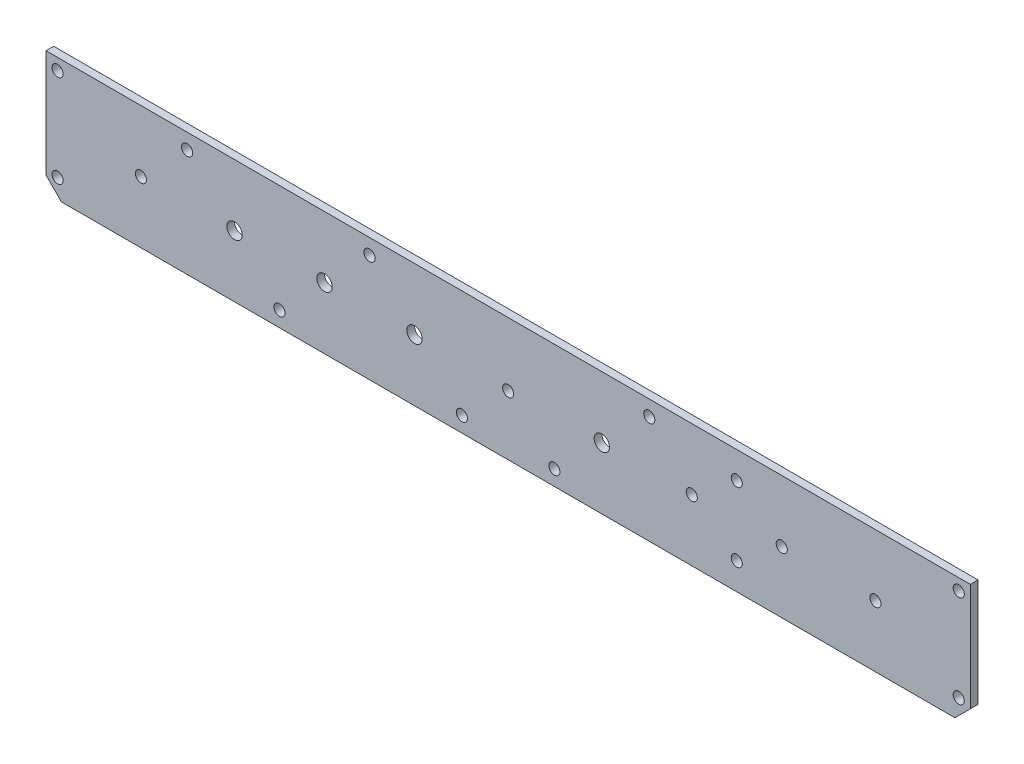
from build123d import *

# Parameters (mm, degrees)
SKETCH1_W           = 381
SKETCH1_H           = 50.8
BOSS_EXTRUDE1_DEPTH = 3.175
CUT_EXTRUDE1_REACH  = 386.385
SKETCH2_R           = 2.286
SKETCH2_R_2         = 3.175


with BuildPart() as part:
    # Sketch1 → Boss-Extrude1 (new body)
    with BuildSketch(Plane.XY):
        with Locations((190.5, 25.4)):
            Rectangle(SKETCH1_W, SKETCH1_H)
    extrude(amount=BOSS_EXTRUDE1_DEPTH)

    # Sketch2 → Cut-Extrude1 (cut, up to next)
    with BuildSketch(Plane.XY.offset(3.175), mode=Mode.PRIVATE) as cut_extrude1_sk1:
        with Locations((39.116, 25.4)):
            Circle(SKETCH2_R)
    cut_extrude1_tool1 = extrude(cut_extrude1_sk1.sketch, amount=-CUT_EXTRUDE1_REACH, mode=Mode.PRIVATE) & part.part
    # Sketch2 → Cut-Extrude1 (cut, up to next)
    with BuildSketch(Plane.XY.offset(3.175), mode=Mode.PRIVATE) as cut_extrude1_sk2:
        with Locations((190.5, 24.60625)):
            Circle(SKETCH2_R)
    cut_extrude1_tool2 = extrude(cut_extrude1_sk2.sketch, amount=-CUT_EXTRUDE1_REACH, mode=Mode.PRIVATE) & part.part
    # Sketch2 → Cut-Extrude1 (cut, up to next)
    with BuildSketch(Plane.XY.offset(3.175), mode=Mode.PRIVATE) as cut_extrude1_sk3:
        with Locations((114.808, 25.4)):
            Circle(SKETCH2_R_2)
    cut_extrude1_tool3 = extrude(cut_extrude1_sk3.sketch, amount=-CUT_EXTRUDE1_REACH, mode=Mode.PRIVATE) & part.part
    # Sketch2 → Cut-Extrude1 (cut, up to next)
    with BuildSketch(Plane.XY.offset(3.175), mode=Mode.PRIVATE) as cut_extrude1_sk4:
        with Locations((77.724, 25.4)):
            Circle(SKETCH2_R_2)
    cut_extrude1_tool4 = extrude(cut_extrude1_sk4.sketch, amount=-CUT_EXTRUDE1_REACH, mode=Mode.PRIVATE) & part.part
    # Sketch2 → Cut-Extrude1 (cut, up to next)
    with BuildSketch(Plane.XY.offset(3.175), mode=Mode.PRIVATE) as cut_extrude1_sk5:
        with Locations((151.892, 25.4)):
            Circle(SKETCH2_R_2)
    cut_extrude1_tool5 = extrude(cut_extrude1_sk5.sketch, amount=-CUT_EXTRUDE1_REACH, mode=Mode.PRIVATE) & part.part
    # Sketch2 → Cut-Extrude1 (cut, up to next)
    with BuildSketch(Plane.XY.offset(3.175), mode=Mode.PRIVATE) as cut_extrude1_sk6:
        with Locations((229.108, 25.4)):
            Circle(SKETCH2_R_2)
    cut_extrude1_tool6 = extrude(cut_extrude1_sk6.sketch, amount=-CUT_EXTRUDE1_REACH, mode=Mode.PRIVATE) & part.part
    # Sketch2 → Cut-Extrude1 (cut, up to next)
    with BuildSketch(Plane.XY.offset(3.175), mode=Mode.PRIVATE) as cut_extrude1_sk7:
        with Locations((303.276, 25.4)):
            Circle(SKETCH2_R)
    cut_extrude1_tool7 = extrude(cut_extrude1_sk7.sketch, amount=-CUT_EXTRUDE1_REACH, mode=Mode.PRIVATE) & part.part
    # Sketch2 → Cut-Extrude1 (cut, up to next)
    with BuildSketch(Plane.XY.offset(3.175), mode=Mode.PRIVATE) as cut_extrude1_sk8:
        with Locations((266.192, 25.4)):
            Circle(SKETCH2_R)
    cut_extrude1_tool8 = extrude(cut_extrude1_sk8.sketch, amount=-CUT_EXTRUDE1_REACH, mode=Mode.PRIVATE) & part.part
    # Sketch2 → Cut-Extrude1 (cut, up to next)
    with BuildSketch(Plane.XY.offset(3.175), mode=Mode.PRIVATE) as cut_extrude1_sk9:
        with Locations((341.884, 25.4)):
            Circle(SKETCH2_R)
    cut_extrude1_tool9 = extrude(cut_extrude1_sk9.sketch, amount=-CUT_EXTRUDE1_REACH, mode=Mode.PRIVATE) & part.part
    # Sketch2 → Cut-Extrude1 (cut, up to next)
    with BuildSketch(Plane.XY.offset(3.175), mode=Mode.PRIVATE) as cut_extrude1_sk10:
        with Locations((58.166, 44.45)):
            Circle(SKETCH2_R)
    cut_extrude1_tool10 = extrude(cut_extrude1_sk10.sketch, amount=-CUT_EXTRUDE1_REACH, mode=Mode.PRIVATE) & part.part
    # Sketch2 → Cut-Extrude1 (cut, up to next)
    with BuildSketch(Plane.XY.offset(3.175), mode=Mode.PRIVATE) as cut_extrude1_sk11:
        with Locations((171.45, 6.35)):
            Circle(SKETCH2_R)
    cut_extrude1_tool11 = extrude(cut_extrude1_sk11.sketch, amount=-CUT_EXTRUDE1_REACH, mode=Mode.PRIVATE) & part.part
    # Sketch2 → Cut-Extrude1 (cut, up to next)
    with BuildSketch(Plane.XY.offset(3.175), mode=Mode.PRIVATE) as cut_extrude1_sk12:
        with Locations((209.55, 6.35)):
            Circle(SKETCH2_R)
    cut_extrude1_tool12 = extrude(cut_extrude1_sk12.sketch, amount=-CUT_EXTRUDE1_REACH, mode=Mode.PRIVATE) & part.part
    # Sketch2 → Cut-Extrude1 (cut, up to next)
    with BuildSketch(Plane.XY.offset(3.175), mode=Mode.PRIVATE) as cut_extrude1_sk13:
        with Locations((133.35, 44.45)):
            Circle(SKETCH2_R)
    cut_extrude1_tool13 = extrude(cut_extrude1_sk13.sketch, amount=-CUT_EXTRUDE1_REACH, mode=Mode.PRIVATE) & part.part
    # Sketch2 → Cut-Extrude1 (cut, up to next)
    with BuildSketch(Plane.XY.offset(3.175), mode=Mode.PRIVATE) as cut_extrude1_sk14:
        with Locations((248.666, 44.45)):
            Circle(SKETCH2_R)
    cut_extrude1_tool14 = extrude(cut_extrude1_sk14.sketch, amount=-CUT_EXTRUDE1_REACH, mode=Mode.PRIVATE) & part.part
    # Sketch2 → Cut-Extrude1 (cut, up to next)
    with BuildSketch(Plane.XY.offset(3.175), mode=Mode.PRIVATE) as cut_extrude1_sk15:
        with Locations((96.266, 6.35)):
            Circle(SKETCH2_R)
    cut_extrude1_tool15 = extrude(cut_extrude1_sk15.sketch, amount=-CUT_EXTRUDE1_REACH, mode=Mode.PRIVATE) & part.part
    # Sketch2 → Cut-Extrude1 (cut, up to next)
    with BuildSketch(Plane.XY.offset(3.175), mode=Mode.PRIVATE) as cut_extrude1_sk16:
        with Locations((4.7625, 46.0375)):
            Circle(SKETCH2_R)
    cut_extrude1_tool16 = extrude(cut_extrude1_sk16.sketch, amount=-CUT_EXTRUDE1_REACH, mode=Mode.PRIVATE) & part.part
    # Sketch2 → Cut-Extrude1 (cut, up to next)
    with BuildSketch(Plane.XY.offset(3.175), mode=Mode.PRIVATE) as cut_extrude1_sk17:
        with Locations((4.7625, 7.9375)):
            Circle(SKETCH2_R)
    cut_extrude1_tool17 = extrude(cut_extrude1_sk17.sketch, amount=-CUT_EXTRUDE1_REACH, mode=Mode.PRIVATE) & part.part
    # Sketch2 → Cut-Extrude1 (cut, up to next)
    with BuildSketch(Plane.XY.offset(3.175), mode=Mode.PRIVATE) as cut_extrude1_sk18:
        with Locations((376.2375, 7.9375)):
            Circle(SKETCH2_R)
    cut_extrude1_tool18 = extrude(cut_extrude1_sk18.sketch, amount=-CUT_EXTRUDE1_REACH, mode=Mode.PRIVATE) & part.part
    # Sketch2 → Cut-Extrude1 (cut, up to next)
    with BuildSketch(Plane.XY.offset(3.175), mode=Mode.PRIVATE) as cut_extrude1_sk19:
        with Locations((376.2375, 46.0375)):
            Circle(SKETCH2_R)
    cut_extrude1_tool19 = extrude(cut_extrude1_sk19.sketch, amount=-CUT_EXTRUDE1_REACH, mode=Mode.PRIVATE) & part.part
    # Sketch2 → Cut-Extrude1 (cut, up to next)
    with BuildSketch(Plane.XY.offset(3.175), mode=Mode.PRIVATE) as cut_extrude1_sk20:
        with Locations((284.734, 11.1125)):
            Circle(SKETCH2_R)
    cut_extrude1_tool20 = extrude(cut_extrude1_sk20.sketch, amount=-CUT_EXTRUDE1_REACH, mode=Mode.PRIVATE) & part.part
    # Sketch2 → Cut-Extrude1 (cut, up to next)
    with BuildSketch(Plane.XY.offset(3.175), mode=Mode.PRIVATE) as cut_extrude1_sk21:
        with Locations((284.734, 39.6875)):
            Circle(SKETCH2_R)
    cut_extrude1_tool21 = extrude(cut_extrude1_sk21.sketch, amount=-CUT_EXTRUDE1_REACH, mode=Mode.PRIVATE) & part.part
    # Sketch2 → Cut-Extrude1 (cut, up to next)
    with BuildSketch(Plane.XY.offset(3.175), mode=Mode.PRIVATE) as cut_extrude1_sk22:
        Polygon((0, 6.35), (0, 0), (6.35, 0), align=None)
    cut_extrude1_tool22 = extrude(cut_extrude1_sk22.sketch, amount=-CUT_EXTRUDE1_REACH, mode=Mode.PRIVATE) & part.part
    # Sketch2 → Cut-Extrude1 (cut, up to next)
    with BuildSketch(Plane.XY.offset(3.175), mode=Mode.PRIVATE) as cut_extrude1_sk23:
        Polygon((381, 0), (374.65, 0), (381, 6.35), align=None)
    cut_extrude1_tool23 = extrude(cut_extrude1_sk23.sketch, amount=-CUT_EXTRUDE1_REACH, mode=Mode.PRIVATE) & part.part
    add(cut_extrude1_tool1.solids().sort_by_distance((39.116, 25.4, 3.175))[0], mode=Mode.SUBTRACT)
    add(cut_extrude1_tool2.solids().sort_by_distance((190.5, 24.60625, 3.175))[0], mode=Mode.SUBTRACT)
    add(cut_extrude1_tool3.solids().sort_by_distance((114.808, 25.4, 3.175))[0], mode=Mode.SUBTRACT)
    add(cut_extrude1_tool4.solids().sort_by_distance((77.724, 25.4, 3.175))[0], mode=Mode.SUBTRACT)
    add(cut_extrude1_tool5.solids().sort_by_distance((151.892, 25.4, 3.175))[0], mode=Mode.SUBTRACT)
    add(cut_extrude1_tool6.solids().sort_by_distance((229.108, 25.4, 3.175))[0], mode=Mode.SUBTRACT)
    add(cut_extrude1_tool7.solids().sort_by_distance((303.276, 25.4, 3.175))[0], mode=Mode.SUBTRACT)
    add(cut_extrude1_tool8.solids().sort_by_distance((266.192, 25.4, 3.175))[0], mode=Mode.SUBTRACT)
    add(cut_extrude1_tool9.solids().sort_by_distance((341.884, 25.4, 3.175))[0], mode=Mode.SUBTRACT)
    add(cut_extrude1_tool10.solids().sort_by_distance((58.166, 44.45, 3.175))[0], mode=Mode.SUBTRACT)
    add(cut_extrude1_tool11.solids().sort_by_distance((171.45, 6.35, 3.175))[0], mode=Mode.SUBTRACT)
    add(cut_extrude1_tool12.solids().sort_by_distance((209.55, 6.35, 3.175))[0], mode=Mode.SUBTRACT)
    add(cut_extrude1_tool13.solids().sort_by_distance((133.35, 44.45, 3.175))[0], mode=Mode.SUBTRACT)
    add(cut_extrude1_tool14.solids().sort_by_distance((248.666, 44.45, 3.175))[0], mode=Mode.SUBTRACT)
    add(cut_extrude1_tool15.solids().sort_by_distance((96.266, 6.35, 3.175))[0], mode=Mode.SUBTRACT)
    add(cut_extrude1_tool16.solids().sort_by_distance((4.7625, 46.0375, 3.175))[0], mode=Mode.SUBTRACT)
    add(cut_extrude1_tool17.solids().sort_by_distance((4.7625, 7.9375, 3.175))[0], mode=Mode.SUBTRACT)
    add(cut_extrude1_tool18.solids().sort_by_distance((376.2375, 7.9375, 3.175))[0], mode=Mode.SUBTRACT)
    add(cut_extrude1_tool19.solids().sort_by_distance((376.2375, 46.0375, 3.175))[0], mode=Mode.SUBTRACT)
    add(cut_extrude1_tool20.solids().sort_by_distance((284.734, 11.1125, 3.175))[0], mode=Mode.SUBTRACT)
    add(cut_extrude1_tool21.solids().sort_by_distance((284.734, 39.6875, 3.175))[0], mode=Mode.SUBTRACT)
    add(cut_extrude1_tool22.solids().sort_by_distance((2.116667, 2.116667, 3.175))[0], mode=Mode.SUBTRACT)
    add(cut_extrude1_tool23.solids().sort_by_distance((378.883333, 2.116667, 3.175))[0], mode=Mode.SUBTRACT)


solid = part.part
